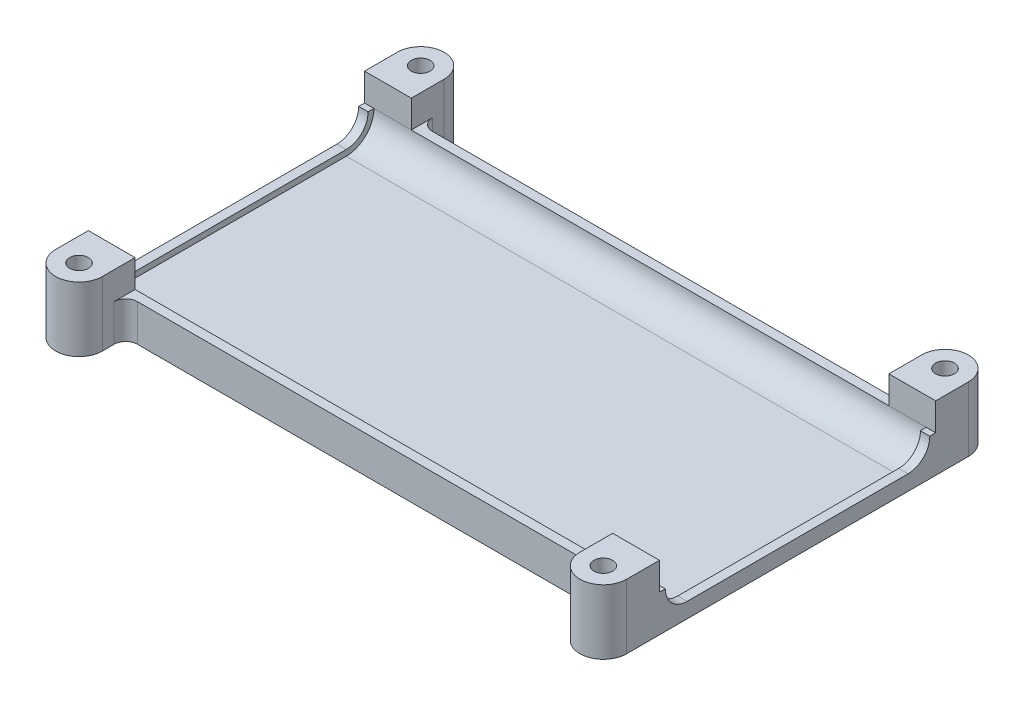
from build123d import *

# Parameters (mm, degrees)
BOSS_EXTRUDE1_DEPTH    = 17.539999972
F_10_CLEARANCE_HOLE1_D = 5.1054
SKETCH3_W              = 150
SKETCH3_H              = 75
CUT_EXTRUDE1_DEPTH     = 14.999999972
SKETCH4_W              = 155.08
SKETCH4_H              = 71.825
CUT_EXTRUDE2_DEPTH     = 13.412499972
CUT_EXTRUDE3_DEPTH     = 7.5
FILLET2_R              = 5.9125
FILLET1_R              = 7.5
FILLET3_R              = 3.175


with BuildPart() as part:
    # Sketch1 → Boss-Extrude1 (new body)
    with BuildSketch(Plane(origin=(0, 0, 0), x_dir=(1, 0, 0), z_dir=(0, 1, 0))):
        with BuildLine():
            Line((77.54, -40.04), (77.54, 40.04))
            Line((77.54, 40.04), (77.54, 46.39))
            ThreePointArc((77.54, 46.39), (71.19, 52.74), (64.84, 46.39))
            Line((64.84, 46.39), (64.84, 40.04))
            Line((64.84, 40.04), (-64.84, 40.04))
            Line((-64.84, 40.04), (-64.84, 46.39))
            ThreePointArc((-64.84, 46.39), (-71.19, 52.74), (-77.54, 46.39))
            Line((-77.54, 46.39), (-77.54, 40.04))
            Line((-77.54, 40.04), (-77.54, -40.04))
            Line((-77.54, -40.04), (-77.54, -46.39))
            ThreePointArc((-77.54, -46.39), (-71.19, -52.74), (-64.84, -46.39))
            Line((-64.84, -46.39), (-64.84, -40.04))
            Line((-64.84, -40.04), (64.84, -40.04))
            Line((64.84, -40.04), (64.84, -46.39))
            ThreePointArc((64.84, -46.39), (71.19, -52.74), (77.54, -46.39))
            Line((77.54, -46.39), (77.54, -40.04))
        make_face()
    extrude(amount=BOSS_EXTRUDE1_DEPTH)

    # #10 Clearance Hole1 (through all)
    with Locations(Plane(origin=(0, 17.539999972, 0), x_dir=(1, 0, 0), z_dir=(0, 1, 0))):
        with Locations((-71.19, 46.39), (71.19, 46.39), (71.19, -46.39), (-71.19, -46.39)):
            Hole(F_10_CLEARANCE_HOLE1_D / 2)

    # Sketch3 → Cut-Extrude1 (cut)
    with BuildSketch(Plane(origin=(0, 17.539999972, 0), x_dir=(1, 0, 0), z_dir=(0, 1, 0))):
        Rectangle(SKETCH3_W, SKETCH3_H)
    extrude(amount=-CUT_EXTRUDE1_DEPTH, mode=Mode.SUBTRACT)

    # Sketch4 → Cut-Extrude2 (cut)
    with BuildSketch(Plane(origin=(0, 17.539999972, 0), x_dir=(1, 0, 0), z_dir=(0, 1, 0))):
        Rectangle(SKETCH4_W, SKETCH4_H)
    extrude(amount=-CUT_EXTRUDE2_DEPTH, mode=Mode.SUBTRACT)

    # Sketch8 → Cut-Extrude3 (cut)
    with BuildSketch(Plane(origin=(0, 17.539999972, 0), x_dir=(1, 0, 0), z_dir=(0, 1, 0))):
        Polygon((-77.54, 37.5), (-64.84, 37.5), (-64.84, 40.04), (64.84, 40.04), (64.84, 37.5), (77.54, 37.5), (77.54, -37.5), (64.84, -37.5), (64.84, -40.04), (-64.84, -40.04), (-64.84, -37.5), (-77.54, -37.5), align=None)
    extrude(amount=-CUT_EXTRUDE3_DEPTH, mode=Mode.SUBTRACT)

    # Fillet2
    fillet2_edges = [part.edges().sort_by_distance(p)[0] for p in [
        (-76.27, 4.1275, -35.9125),
        (-76.27, 4.1275, 35.9125),
        (76.27, 4.1275, 35.9125),
        (76.27, 4.1275, -35.9125),
    ]]
    fillet(fillet2_edges, radius=FILLET2_R - 0.0001)  # a hair under: the kernel refuses the full size

    # Fillet1
    fillet1_edges = [part.edges().sort_by_distance(p)[0] for p in [
        (0, 2.54, 37.5),
        (0, 2.54, -37.5),
    ]]
    fillet(fillet1_edges, radius=FILLET1_R - 0.0001)  # a hair under: the kernel refuses the full size

    # Fillet3
    fillet3_edges = [part.edges().sort_by_distance(p)[0] for p in [
        (64.84, 5.019999986, 40.04),
        (-64.84, 5.019999986, 40.04),
        (-64.84, 5.019999986, -40.04),
        (64.84, 5.019999986, -40.04),
    ]]
    fillet(fillet3_edges, radius=FILLET3_R)


solid = part.part
